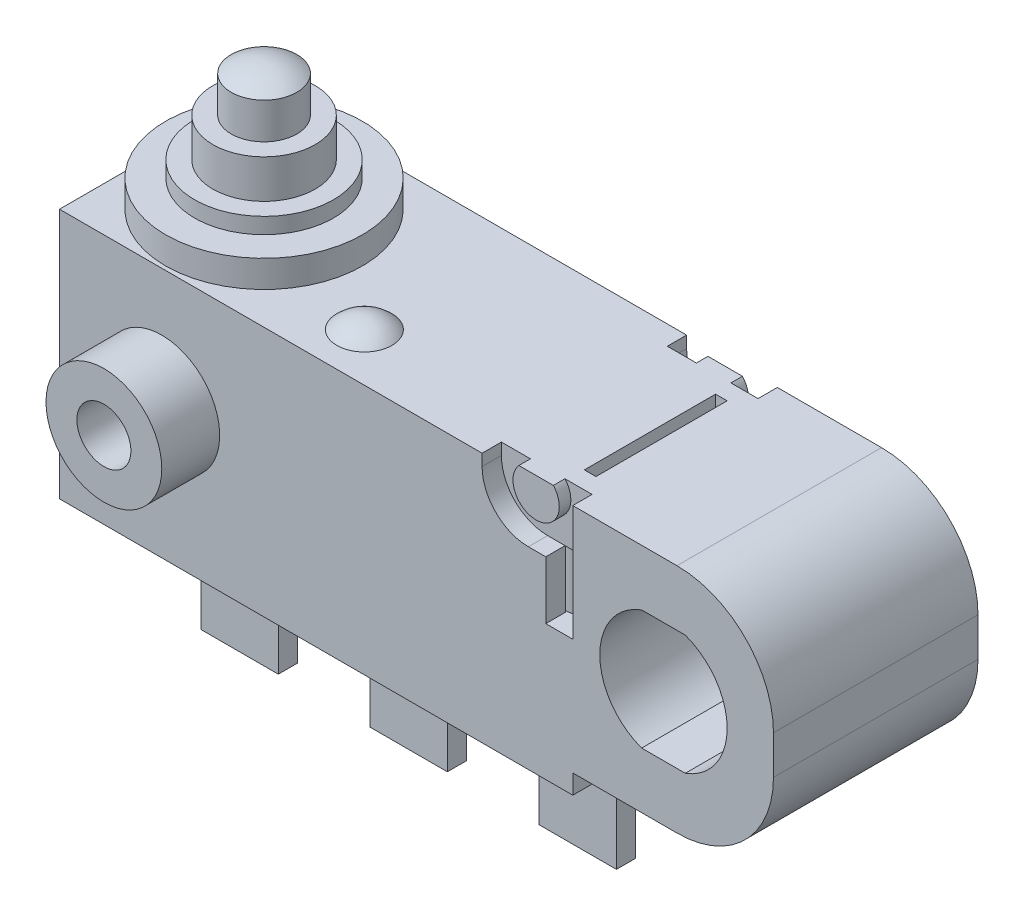
from build123d import *

# Parameters (mm, degrees)
BOSS_EXTRUDE1_START            = -6.5
BOSS_EXTRUDE1_OUTLINE_W        = 7.364142843
BOSS_EXTRUDE1_OUTLINE_H        = 4.764142843
BOSS_EXTRUDE1_DEPTH            = 6.5
SKETCH2_W                      = 7.364142843
SKETCH2_H                      = 6.5
BOSS_EXTRUDE2_DEPTH            = 0.535857157
SKETCH3_W                      = 5.3
SKETCH3_H                      = 6.5
BOSS_EXTRUDE3_DEPTH            = 11.135857157
CUT_EXTRUDE1_DEPTH             = 0.7
SKETCH5_W                      = 1.14
SKETCH5_H                      = 1.5
CUT_EXTRUDE2_DEPTH             = 0.95
CUT_EXTRUDE3_DEPTH             = 0.7
SKETCH7_W                      = 1.14
SKETCH7_H                      = 1.5
CUT_EXTRUDE4_DEPTH             = 0.95
SKETCH8_W                      = 5.2
SKETCH8_H                      = 0.5
CUT_EXTRUDE5_DEPTH             = 18.075201317
CUT_EXTRUDE6_DEPTH             = 18.075201317
SKETCH10_W                     = 2
SKETCH10_H                     = 0.5
BOSS_EXTRUDE4_DEPTH            = 3.5
SKETCH11_W                     = 2
SKETCH11_H                     = 0.5
BOSS_EXTRUDE5_DEPTH            = 3.5
SKETCH12_W                     = 2
SKETCH12_H                     = 0.5
BOSS_EXTRUDE6_DEPTH            = 3.5
SKETCH13_W                     = 0.8
SKETCH13_H                     = 2.7
BOSS_EXTRUDE7_DEPTH            = 0.5
SKETCH14_W                     = 0.8
SKETCH14_H                     = 2.7
BOSS_EXTRUDE8_DEPTH            = 0.5
SKETCH15_R                     = 2.55
BOSS_EXTRUDE9_DEPTH            = 0.7
SKETCH16_R                     = 1.8
BOSS_EXTRUDE10_DEPTH           = 0.411605056
SKETCH17_R                     = 1.325
BOSS_EXTRUDE11_DEPTH           = 1
BOSS_EXTRUDE12_REACH           = 22.64
BOSS_EXTRUDE12_END_RADIUS      = 1.5
SKETCH18_R                     = 0.85
SKETCH19_R                     = 1.5
BOSS_EXTRUDE13_DEPTH           = 1.5
BOSS_EXTRUDE14_START           = 1.5
SKETCH20_R                     = 1.5
BOSS_EXTRUDE14_DEPTH           = 1.5
SKETCH21_W                     = 1.65
SKETCH21_H                     = 0.5
CUT_EXTRUDE7_DEPTH             = 1.5
SKETCH22_W                     = 1.65
SKETCH22_H                     = 0.5
CUT_EXTRUDE8_DEPTH             = 1.5
BOSS_EXTRUDE15_DEPTH           = 0.3
BOSS_EXTRUDE16_START           = 0.3
BOSS_EXTRUDE16_DEPTH           = 0.3
SKETCH25_W                     = 0.29999989
SKETCH25_H                     = 3.4
CUT_EXTRUDE9_DEPTH             = 0.5
SKETCH26_W                     = 1.8
SKETCH26_H                     = 2.5
SKETCH27_W                     = 0.3
SKETCH27_H                     = 1.5
SKETCH28_W                     = 0.3
SKETCH28_H                     = 1.5
F_1_4_1_4_DIAMETER_HOLE1_D     = 1.4
F_1_4_1_4_DIAMETER_HOLE1_DEPTH = 1.5
F_1_4_1_4_DIAMETER_HOLE2_D     = 1.4
F_1_4_1_4_DIAMETER_HOLE2_DEPTH = 1.5
FILLET1_R                      = 1.2
FILLET2_R                      = 2.5


with BuildPart() as part:
    # Boss-Extrude1: read off the stored shape, not the designer's step
    # Boss-Extrude1 outline → Boss-Extrude1 (new body)
    with BuildSketch(Plane(origin=(0, 3, 0), x_dir=(1, 0, 0), z_dir=(0, 1, 0)).offset(BOSS_EXTRUDE1_START)):
        with Locations((1.032071421, 2.917928579)):
            Rectangle(BOSS_EXTRUDE1_OUTLINE_W, BOSS_EXTRUDE1_OUTLINE_H)
    extrude(amount=BOSS_EXTRUDE1_DEPTH)

    # Boss-Extrude1 2 outline → Boss-Extrude1 2 (revolve)
    with BuildSketch(Plane(origin=(4, 0, -1.25), x_dir=(1, 0, 0), z_dir=(0, 0, 1))):
        with BuildLine():
            Line((0, 2.999999999), (0.714142844, 2.999999999))
            ThreePointArc((0.714142844, 2.999999999), (0.387298335, 3.221954446), (0, 3.3))
            Line((0, 3.3), (0, 2.999999999))
        make_face()
    revolve(axis=Axis((4, 0, -1.25), (0, 1, 0)))

    # Sketch2 → Boss-Extrude2 (add)
    with BuildSketch(Plane.XY.offset(-0.535857157)):
        with Locations((1.032071421, -0.25)):
            Rectangle(SKETCH2_W, SKETCH2_H)
    extrude(amount=BOSS_EXTRUDE2_DEPTH)

    # Sketch3 → Boss-Extrude3 (add)
    with BuildSketch(Plane(origin=(4.714142843, 0, 0), x_dir=(0, 0, -1), z_dir=(1, 0, 0))):
        with Locations((2.65, -0.25)):
            Rectangle(SKETCH3_W, SKETCH3_H)
    extrude(amount=BOSS_EXTRUDE3_DEPTH)

    # Sketch4 → Cut-Extrude1 (cut)
    with BuildSketch(Plane(origin=(9.95, 0, 0), x_dir=(0, -1, 0), z_dir=(-1, 0, 0))):
        Polygon((-1.5, -0.5), (-1.5, -1.65), (0, -1.65), (0, 0), (-3, 0), (-3, -0.5), align=None)
    extrude(amount=-CUT_EXTRUDE1_DEPTH, mode=Mode.SUBTRACT)

    # Sketch5 → Cut-Extrude2 (cut)
    with BuildSketch(Plane(origin=(9.95, 0, 0), x_dir=(0, 0, -1), z_dir=(1, 0, 0))):
        with Locations((1.08, 0.75)):
            Rectangle(SKETCH5_W, SKETCH5_H)
    extrude(amount=-CUT_EXTRUDE2_DEPTH, mode=Mode.SUBTRACT)

    # Sketch6 → Cut-Extrude3 (cut)
    with BuildSketch(Plane(origin=(9.95, 0, 0), x_dir=(0, -1, 0), z_dir=(-1, 0, 0))):
        Polygon((-3, -5.3), (0, -5.3), (0, -3.65), (-1.5, -3.65), (-1.5, -4.8), (-3, -4.8), align=None)
    extrude(amount=-CUT_EXTRUDE3_DEPTH, mode=Mode.SUBTRACT)

    # Sketch7 → Cut-Extrude4 (cut)
    with BuildSketch(Plane(origin=(9.95, 0, 0), x_dir=(0, 0, -1), z_dir=(1, 0, 0))):
        with Locations((4.22, 0.75)):
            Rectangle(SKETCH7_W, SKETCH7_H)
    extrude(amount=-CUT_EXTRUDE4_DEPTH, mode=Mode.SUBTRACT)

    # Sketch8 → Cut-Extrude5 (cut, through all)
    with BuildSketch(Plane.XY):
        with Locations((13.25, -3.25)):
            Rectangle(SKETCH8_W, SKETCH8_H)
    extrude(amount=-CUT_EXTRUDE5_DEPTH, mode=Mode.SUBTRACT)

    # Sketch9 → Cut-Extrude6 (cut, through all)
    with BuildSketch(Plane.XY):
        with BuildLine():
            Line((13.565685425, 1.55), (12.434314575, 1.55))
            ThreePointArc((12.434314575, 1.55), (11.35, 0), (12.434314575, -1.55))
            Line((12.434314575, -1.55), (13.565685425, -1.55))
            ThreePointArc((13.565685425, -1.55), (14.65, 0), (13.565685425, 1.55))
        make_face()
    extrude(amount=-CUT_EXTRUDE6_DEPTH, mode=Mode.SUBTRACT)

    # Sketch10 → Boss-Extrude4 (add)
    with BuildSketch(Plane.XZ.offset(3.5)):
        with Locations((-0.38, -2.65)):
            Rectangle(SKETCH10_W, SKETCH10_H)
    extrude(amount=BOSS_EXTRUDE4_DEPTH)

    # Sketch11 → Boss-Extrude5 (add)
    with BuildSketch(Plane.XZ.offset(3.5)):
        with Locations((4, -2.65)):
            Rectangle(SKETCH11_W, SKETCH11_H)
    extrude(amount=BOSS_EXTRUDE5_DEPTH)

    # Sketch12 → Boss-Extrude6 (add)
    with BuildSketch(Plane.XZ.offset(3.5)):
        with Locations((8.38, -2.65)):
            Rectangle(SKETCH12_W, SKETCH12_H)
    extrude(amount=BOSS_EXTRUDE6_DEPTH)

    # Sketch13 → Boss-Extrude7 (add)
    with BuildSketch(Plane.XZ.offset(3.5)):
        with Locations((1.45, -2.65)):
            Rectangle(SKETCH13_W, SKETCH13_H)
    extrude(amount=BOSS_EXTRUDE7_DEPTH)

    # Sketch14 → Boss-Extrude8 (add)
    with BuildSketch(Plane.XZ.offset(3.5)):
        with Locations((6.55, -2.65)):
            Rectangle(SKETCH14_W, SKETCH14_H)
    extrude(amount=BOSS_EXTRUDE8_DEPTH)

    # Sketch15 → Boss-Extrude9 (add)
    with BuildSketch(Plane(origin=(0, 3, 0), x_dir=(-1, 0, 0), z_dir=(0, 1, 0))):
        with Locations(Location((0, -2.65, 0), (0, 0, 90))):
            Circle(SKETCH15_R)
    extrude(amount=BOSS_EXTRUDE9_DEPTH)

    # Sketch16 → Boss-Extrude10 (add)
    with BuildSketch(Plane(origin=(0, 3.7, 0), x_dir=(-1, 0, 0), z_dir=(0, 1, 0))):
        with Locations(Location((0, -2.65, 0), (0, 0, 270))):
            Circle(SKETCH16_R)
    extrude(amount=BOSS_EXTRUDE10_DEPTH)

    # Sketch17 → Boss-Extrude11 (add)
    with BuildSketch(Plane(origin=(0, 4.111605056, 0), x_dir=(-1, 0, 0), z_dir=(0, 1, 0))):
        with Locations(Location((0, -2.65, 0), (0, 0, 90))):
            Circle(SKETCH17_R)
    extrude(amount=BOSS_EXTRUDE11_DEPTH)

    # Boss-Extrude12: up to this sphere (the profile starts inside it)
    boss_extrude12_end = Location((0, 4.811605056, -2.65)) * Sphere(BOSS_EXTRUDE12_END_RADIUS, mode=Mode.PRIVATE)
    # Sketch18 → Boss-Extrude12 (add, up to the surface)
    with BuildSketch(Plane(origin=(0, 5.111605056, 0), x_dir=(-1, 0, 0), z_dir=(0, 1, 0)), mode=Mode.PRIVATE) as boss_extrude12_sk1:
        with Locations(Location((0, -2.65, 0), (0, 0, 90))):
            Circle(SKETCH18_R)
    boss_extrude12_tool1 = extrude(boss_extrude12_sk1.sketch, amount=BOSS_EXTRUDE12_REACH, mode=Mode.PRIVATE) & boss_extrude12_end
    add(boss_extrude12_tool1.solids().sort_by_distance((0, 5.111605, -2.65))[0])

    # Sketch19 → Boss-Extrude13 (add)
    with BuildSketch(Plane.XY):
        with Locations(Location((0, 0, 0), (0, 0, 180))):
            Circle(SKETCH19_R)
    extrude(amount=BOSS_EXTRUDE13_DEPTH)

    # Sketch20 → Boss-Extrude14 (add)
    with BuildSketch(Plane(origin=(0, 0, -5.3), x_dir=(-1, 0, 0), z_dir=(0, 0, -1)).offset(BOSS_EXTRUDE14_START)):
        Circle(SKETCH20_R)
    extrude(amount=-BOSS_EXTRUDE14_DEPTH)

    # Sketch21 → Cut-Extrude7 (cut)
    with BuildSketch(Plane(origin=(0, 3, 0), x_dir=(-1, 0, 0), z_dir=(0, 1, 0))):
        with Locations((-9.125, -0.25)):
            Rectangle(SKETCH21_W, SKETCH21_H)
    extrude(amount=-CUT_EXTRUDE7_DEPTH, mode=Mode.SUBTRACT)

    # Sketch22 → Cut-Extrude8 (cut)
    with BuildSketch(Plane(origin=(0, 3, 0), x_dir=(-1, 0, 0), z_dir=(0, 1, 0))):
        with Locations((-9.125, -5.05)):
            Rectangle(SKETCH22_W, SKETCH22_H)
    extrude(amount=-CUT_EXTRUDE8_DEPTH, mode=Mode.SUBTRACT)

    # Sketch23 → Boss-Extrude15 (add)
    with BuildSketch(Plane.XY.offset(-0.5)):
        with BuildLine():
            Line((9.052786405, 3), (9.947213595, 3))
            ThreePointArc((9.947213595, 3), (9.5, 2), (9.052786405, 3))
        make_face()
    extrude(amount=BOSS_EXTRUDE15_DEPTH)

    # Sketch24 → Boss-Extrude16 (add)
    with BuildSketch(Plane(origin=(0, 0, -4.8), x_dir=(-1, 0, 0), z_dir=(0, 0, -1)).offset(BOSS_EXTRUDE16_START)):
        with BuildLine():
            Line((-9.947213595, 3), (-9.052786405, 3))
            ThreePointArc((-9.052786405, 3), (-9.5, 2), (-9.947213595, 3))
        make_face()
    extrude(amount=-BOSS_EXTRUDE16_DEPTH)

    # Sketch25 → Cut-Extrude9 (cut)
    with BuildSketch(Plane(origin=(0, 3, 0), x_dir=(-1, 0, 0), z_dir=(0, 1, 0))):
        with Locations((-10.149999945, -2.65)):
            Rectangle(SKETCH25_W, SKETCH25_H)
    extrude(amount=-CUT_EXTRUDE9_DEPTH, mode=Mode.SUBTRACT)

    # Sketch26 → Cut-Revolve1 (revolve, cut)
    with BuildSketch(Plane(origin=(0, 0, -2.65), x_dir=(-1, 0, 0), z_dir=(0, 0, -1))):
        with Locations((-0.9, 1.75)):
            Rectangle(SKETCH26_W, SKETCH26_H)
    revolve(axis=Axis((0, 0.5, -2.65), (0, 1, 0)), mode=Mode.SUBTRACT)

    # Sketch27 → Revolve1 (revolve)
    with BuildSketch(Plane.XY.offset(-4.45), mode=Mode.PRIVATE) as revolve1_sk:
        with Locations((10.1, 0.75)):
            Rectangle(SKETCH27_W, SKETCH27_H)
    revolve(revolve1_sk.sketch.rotate(Axis((9.95, 1.5, -4.45), (0, -1, 0)), 270), axis=Axis((9.95, 1.5, -4.45), (0, -1, 0)))

    # Sketch28 → Revolve2 (revolve)
    with BuildSketch(Plane.XY.offset(-0.85), mode=Mode.PRIVATE) as revolve2_sk:
        with Locations((10.1, 0.75)):
            Rectangle(SKETCH28_W, SKETCH28_H)
    revolve(revolve2_sk.sketch.rotate(Axis((9.95, 1.5, -0.85), (0, -1, 0)), 270), axis=Axis((9.95, 1.5, -0.85), (0, -1, 0)))

    # Ø1.4 (1.4) Diameter Hole1
    with Locations(Plane(origin=(0, 0, -6.8), x_dir=(-1, 0, 0), z_dir=(0, 0, -1))):
        with Locations((0.093266982, 0)):
            Hole(F_1_4_1_4_DIAMETER_HOLE1_D / 2, depth=F_1_4_1_4_DIAMETER_HOLE1_DEPTH)

    # Ø1.4 (1.4) Diameter Hole2
    with Locations(Plane.XY.offset(1.5)):
        with Locations((0, 0)):
            Hole(F_1_4_1_4_DIAMETER_HOLE2_D / 2, depth=F_1_4_1_4_DIAMETER_HOLE2_DEPTH)

    # Fillet1
    fillet1_edges = [part.edges().sort_by_distance(p)[0] for p in [
        (8.3, 1.5, -0.25),
        (8.3, 1.5, -5.05),
    ]]
    fillet(fillet1_edges, radius=FILLET1_R)

    # Fillet2
    fillet2_edges = [part.edges().sort_by_distance(p)[0] for p in [
        (15.85, 3, -2.65),
        (15.85, -3, -2.65),
    ]]
    fillet(fillet2_edges, radius=FILLET2_R)


solid = part.part
